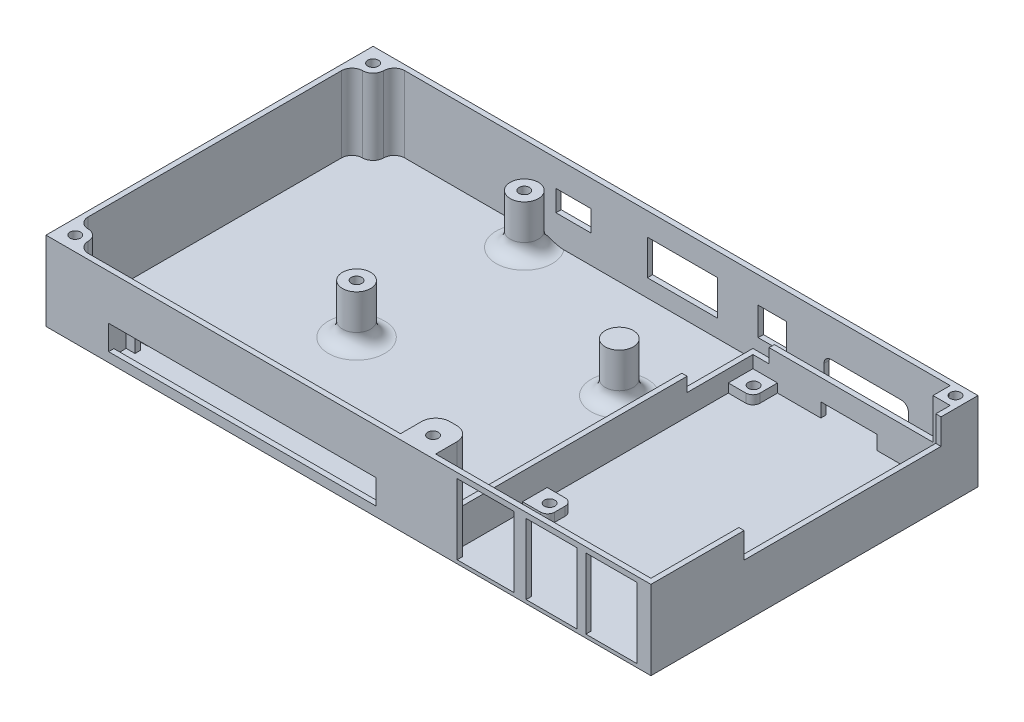
from build123d import *

# Parameters (mm, degrees)
SKETCH1_W              = 172
SKETCH1_H              = 93
BOSS_EXTRUDE1_DEPTH    = 1
SKETCH2_W              = 172
SKETCH2_H              = 93
SKETCH2_W_2            = 169
SKETCH2_H_2            = 90
BOSS_EXTRUDE2_DEPTH    = 21.5
SKETCH3_W              = 14.5
SKETCH3_H              = 20
SKETCH3_W_2            = 16.2
SKETCH3_W_3            = 76
SKETCH3_H_2            = 7
CUT_EXTRUDE1_DEPTH     = 21.5
BOSS_EXTRUDE3_DEPTH    = 10
FILLET1_R              = 4
SKETCH5_R              = 1.5
BOSS_EXTRUDE4_DEPTH    = 2.5
BOSS_EXTRUDE5_DEPTH    = 10
SKETCH7_W              = 1.5
SKETCH7_H              = 3.5
BOSS_EXTRUDE6_DEPTH    = 10
FILLET2_R              = 4
SKETCH8_R              = 4
SKETCH8_R_2            = 1.5
BOSS_EXTRUDE7_DEPTH    = 14
SKETCH10_W             = 16
SKETCH10_H             = 4
CUT_EXTRUDE2_DEPTH     = 14
CUT_EXTRUDE3_DEPTH     = 1.6
FILLET3_R              = 4
SKETCH12_W             = 10
SKETCH12_H             = 6
SKETCH12_W_2           = 8
SKETCH12_H_2           = 8
CUT_EXTRUDE4_DEPTH     = 25.1
SKETCH13_W             = 6.4
SKETCH13_H             = 6.4
SKETCH13_W_2           = 6
SKETCH13_H_2           = 6
BOSS_EXTRUDE8_DEPTH    = 21.5
FILLET4_R              = 3
SKETCH14_R             = 1.5
CUT_EXTRUDE5_DEPTH     = 20
SKETCH15_W             = 172
SKETCH15_H             = 93
SKETCH15_R             = 1.5
SKETCH15_W_2           = 4
SKETCH15_H_2           = 40
SKETCH15_W_3           = 45
SKETCH15_H_3           = 6.0381788
BOSS_EXTRUDE9_DEPTH    = 2
SKETCH16_W             = 56
SKETCH16_H             = 7.274551358
CUT_EXTRUDE6_DEPTH     = 2
INTERSECT2_START       = 22.5
INTERSECT2_OUTLINE_W   = 172
INTERSECT2_OUTLINE_H   = 93
INTERSECT2_OUTLINE_R   = 1.5
INTERSECT2_OUTLINE_W_2 = 45
INTERSECT2_OUTLINE_H_2 = 6.0381788
INTERSECT2_OUTLINE_W_3 = 4
INTERSECT2_OUTLINE_H_3 = 40
INTERSECT2_DEPTH       = 2


# Read off the part's stored shape, not the designer's step: Intersect2
# Some blends are built 0.0001 mm under size
with BuildPart() as part:
    # Sketch1 → Boss-Extrude1 (new body)
    with BuildSketch(Plane(origin=(0, 0, 0), x_dir=(1, 0, 0), z_dir=(0, 1, 0))):
        Rectangle(SKETCH1_W, SKETCH1_H)
    extrude(amount=BOSS_EXTRUDE1_DEPTH)

    # Sketch2 → Boss-Extrude2 (add)
    with BuildSketch(Plane(origin=(0, 1, 0), x_dir=(1, 0, 0), z_dir=(0, 1, 0))):
        Rectangle(SKETCH2_W, SKETCH2_H)
        Rectangle(SKETCH2_W_2, SKETCH2_H_2, mode=Mode.SUBTRACT)
    extrude(amount=BOSS_EXTRUDE2_DEPTH)

    # Sketch3 → Cut-Extrude1 (cut)
    with BuildSketch(Plane.XY.offset(46.5)):
        with Locations((74.75, 11)):
            Rectangle(SKETCH3_W, SKETCH3_H)
        with Locations((57.75, 11)):
            Rectangle(SKETCH3_W, SKETCH3_H)
        with Locations((39, 11)):
            Rectangle(SKETCH3_W_2, SKETCH3_H)
        with Locations((-30.2, 6.2)):
            Rectangle(SKETCH3_W_3, SKETCH3_H_2)
    extrude(amount=-CUT_EXTRUDE1_DEPTH, mode=Mode.SUBTRACT)

    # Sketch4 → Boss-Extrude3 (add)
    with BuildSketch(Plane(origin=(0, 1, 0), x_dir=(1, 0, 0), z_dir=(0, 1, 0))):
        Polygon((26.9, -45), (28.4, -45), (28.4, 40.1), (84.5, 40.1), (84.5, 41.6), (26.9, 41.6), align=None)
    extrude(amount=BOSS_EXTRUDE3_DEPTH)

    # Fillet1
    fillet1_edges = [part.edges().sort_by_distance(p)[0] for p in [
        (26.9, 6, 45),
    ]]
    fillet(fillet1_edges, radius=FILLET1_R)

    # Sketch5 → Boss-Extrude4 (add)
    # profile 1 of 4: a face of its own
    with BuildSketch(Plane(origin=(0, 1, 0), x_dir=(1, 0, 0), z_dir=(0, 1, 0))):
        with BuildLine():
            Line((28.4, 40.1), (35.4, 40.1))
            Line((35.4, 40.1), (35.4, 35.1))
            ThreePointArc((35.4, 35.1), (34.814213562, 33.685786438), (33.4, 33.1))
            Line((33.4, 33.1), (28.4, 33.1))
            Line((28.4, 33.1), (28.4, 40.1))
        make_face()
        with Locations(Location((32.6, 36.1, 0), (0, 0, 270))):
            Circle(SKETCH5_R, mode=Mode.SUBTRACT)
    # profile 2 of 4: a face of its own
    with BuildSketch(Plane(origin=(0, 1, 0), x_dir=(1, 0, 0), z_dir=(0, 1, 0))):
        with BuildLine():
            Line((84.5, 40.1), (77.5, 40.1))
            Line((77.5, 40.1), (77.5, 35.1))
            ThreePointArc((77.5, 35.1), (78.085786438, 33.685786438), (79.5, 33.1))
            Line((79.5, 33.1), (84.5, 33.1))
            Line((84.5, 33.1), (84.5, 40.1))
        make_face()
        with Locations(Location((80.3, 36.1, 0), (0, 0, 270))):
            Circle(SKETCH5_R, mode=Mode.SUBTRACT)
    # profile 3 of 4: a face of its own
    with BuildSketch(Plane(origin=(0, 1, 0), x_dir=(1, 0, 0), z_dir=(0, 1, 0))):
        with BuildLine():
            Line((28.4, -18.4), (33.533804299, -18.4))
            ThreePointArc((33.533804299, -18.4), (34.948017861, -18.985786438), (35.533804299, -20.4))
            Line((35.533804299, -20.4), (35.533804299, -23.4))
            ThreePointArc((35.533804299, -23.4), (34.948017861, -24.814213562), (33.533804299, -25.4))
            Line((33.533804299, -25.4), (28.4, -25.4))
            Line((28.4, -25.4), (28.4, -18.4))
        make_face()
        with Locations(Location((32.6, -21.9, 0), (0, 0, 270))):
            Circle(SKETCH5_R, mode=Mode.SUBTRACT)
    # profile 4 of 4: a face of its own
    with BuildSketch(Plane(origin=(0, 1, 0), x_dir=(1, 0, 0), z_dir=(0, 1, 0))):
        with BuildLine():
            Line((84.5, -18.4), (79.00543069, -18.4))
            ThreePointArc((79.00543069, -18.4), (77.591217128, -18.985786438), (77.00543069, -20.4))
            Line((77.00543069, -20.4), (77.00543069, -23.4))
            ThreePointArc((77.00543069, -23.4), (77.591217128, -24.814213562), (79.00543069, -25.4))
            Line((79.00543069, -25.4), (84.5, -25.4))
            Line((84.5, -25.4), (84.5, -18.4))
        make_face()
        with Locations(Location((80.3, -21.9, 0), (0, 0, 270))):
            Circle(SKETCH5_R, mode=Mode.SUBTRACT)
    extrude(amount=BOSS_EXTRUDE4_DEPTH)

    # Sketch6 → Boss-Extrude5 (add)
    with BuildSketch(Plane(origin=(0, 1, 0), x_dir=(1, 0, 0), z_dir=(0, 1, 0))):
        Polygon((-65.7, -40), (-68.2, -40), (-68.2, -37.9), (-65.7, -37.9), (-65.7, -36.402716815), (-69.7, -36.402716815), (-69.7, -41.5), (-65.7, -41.5), align=None)
        Polygon((5.3, -36.402716815), (5.3, -37.9), (7.8, -37.9), (7.8, -40), (5.3, -40), (5.3, -41.5), (9.3, -41.5), (9.3, -36.402716815), align=None)
    extrude(amount=BOSS_EXTRUDE5_DEPTH)

    # Sketch7 → Boss-Extrude6 (add)
    with BuildSketch(Plane(origin=(0, 1, 0), x_dir=(1, 0, 0), z_dir=(0, 1, 0))):
        with Locations((-68.95, -43.25)):
            Rectangle(SKETCH7_W, SKETCH7_H)
        with Locations((8.55, -43.25)):
            Rectangle(SKETCH7_W, SKETCH7_H)
    extrude(amount=BOSS_EXTRUDE6_DEPTH)

    # Fillet2
    fillet2_edges = [part.edges().sort_by_distance(p)[0] for p in [
        (-69.7, 6, 45),
        (9.3, 6, 45),
    ]]
    fillet(fillet2_edges, radius=FILLET2_R)

    # Sketch8 → Boss-Extrude7 (add)
    # profile 1 of 3: a face of its own
    with BuildSketch(Plane(origin=(0, 1, 0), x_dir=(1, 0, 0), z_dir=(0, 1, 0))):
        with Locations(Location((-38.2, -6, 0), (0, 0, 90))):
            Circle(SKETCH8_R)
        with Locations(Location((-38.2, -6, 0), (0, 0, 270))):
            Circle(SKETCH8_R_2, mode=Mode.SUBTRACT)
    # profile 2 of 3: a face of its own
    with BuildSketch(Plane(origin=(0, 1, 0), x_dir=(1, 0, 0), z_dir=(0, 1, 0))):
        with Locations(Location((-36.5, 40, 0), (0, 0, 90))):
            Circle(SKETCH8_R)
        with Locations(Location((-36.5, 40, 0), (0, 0, 270))):
            Circle(SKETCH8_R_2, mode=Mode.SUBTRACT)
    # profile 3 of 3: a face of its own
    with BuildSketch(Plane(origin=(0, 1, 0), x_dir=(1, 0, 0), z_dir=(0, 1, 0))):
        with Locations(Location((13.5, 17, 0), (0, 0, 90))):
            Circle(SKETCH8_R)
    extrude(amount=BOSS_EXTRUDE7_DEPTH)

    # Sketch10 → Cut-Extrude2 (cut)
    with BuildSketch(Plane(origin=(0, 0, -46.5), x_dir=(-1, 0, 0), z_dir=(0, 0, -1))):
        with Locations((-55.7, 3)):
            Rectangle(SKETCH10_W, SKETCH10_H)
    extrude(amount=-CUT_EXTRUDE2_DEPTH, mode=Mode.SUBTRACT)

    # Sketch11 → Cut-Extrude3 (cut)
    with BuildSketch(Plane(origin=(0, 0, -46.5), x_dir=(-1, 0, 0), z_dir=(0, 0, -1))):
        with BuildLine():
            Line((-65.7, 12), (-45.7, 12))
            ThreePointArc((-45.7, 12), (-44.285786438, 11.414213562), (-43.7, 10))
            Line((-43.7, 10), (-43.7, 3))
            ThreePointArc((-43.7, 3), (-44.285786438, 1.585786438), (-45.7, 1))
            Line((-45.7, 1), (-65.7, 1))
            ThreePointArc((-65.7, 1), (-67.114213562, 1.585786438), (-67.7, 3))
            Line((-67.7, 3), (-67.7, 10))
            ThreePointArc((-67.7, 10), (-67.114213562, 11.414213562), (-65.7, 12))
        make_face()
    extrude(amount=-CUT_EXTRUDE3_DEPTH, mode=Mode.SUBTRACT)

    # Fillet3
    # the kernel refuses this fillet: 4 mm, written as the material it adds along each edge
    with BuildSketch(Plane(origin=(-36.5, 1, -40), x_dir=(0, 0, -1), z_dir=(1, 0, 0))) as fillet3_piece_1_section:
        with BuildLine():
            CenterArc((4 + FILLET3_R, FILLET3_R), FILLET3_R, 180, 90)
            Line((4, FILLET3_R), (4, 0))
            Line((4, 0), (4 + FILLET3_R, 0))
        make_face()
    fillet3_piece_1 = revolve(axis=Axis((-36.5, 1, -40), (0, 1, 0)), mode=Mode.PRIVATE)
    fillet3_piece_1 = split(fillet3_piece_1, bisect_by=Plane(origin=(-36.5, 2.138882343, -45), z_dir=(0, 0, 1)), keep=Keep.TOP, mode=Mode.PRIVATE)
    add(fillet3_piece_1)
    with BuildSketch(Plane(origin=(-38.2, 1, 6), x_dir=(0, 0, -1), z_dir=(1, 0, 0))) as fillet3_piece_2:
        with BuildLine():
            CenterArc((4 + FILLET3_R, FILLET3_R), FILLET3_R, 180, 90)
            Line((4, FILLET3_R), (4, 0))
            Line((4, 0), (4 + FILLET3_R, 0))
        make_face()
    revolve(axis=Axis((-38.2, 1, 6), (0, 1, 0)))
    with BuildSketch(Plane(origin=(13.5, 1, -17), x_dir=(0, 0, -1), z_dir=(1, 0, 0))) as fillet3_piece_3:
        with BuildLine():
            CenterArc((4 + FILLET3_R, FILLET3_R), FILLET3_R, 180, 90)
            Line((4, FILLET3_R), (4, 0))
            Line((4, 0), (4 + FILLET3_R, 0))
        make_face()
    revolve(axis=Axis((13.5, 1, -17), (0, 1, 0)))

    # Sketch12 → Cut-Extrude4 (cut)
    with BuildSketch(Plane(origin=(0, 0, -46.5), x_dir=(-1, 0, 0), z_dir=(0, 0, -1))):
        with Locations((27.5, 12)):
            Rectangle(SKETCH12_W, SKETCH12_H)
        Polygon((-13.5, 15), (-13.5, 16), (6.5, 16), (6.5, 15), (6.5, 6), (-13.5, 6), align=None)
        with Locations((-29, 11)):
            Rectangle(SKETCH12_W_2, SKETCH12_H_2)
    extrude(amount=-CUT_EXTRUDE4_DEPTH, mode=Mode.SUBTRACT)

    # Sketch13 → Boss-Extrude8 (add)
    with BuildSketch(Plane(origin=(0, 1, 0), x_dir=(1, 0, 0), z_dir=(0, 1, 0))):
        with Locations((82.8, 43.3)):
            Rectangle(SKETCH13_W, SKETCH13_H)
        with Locations((-81.5, 42)):
            Rectangle(SKETCH13_W_2, SKETCH13_H_2)
        with Locations((-81.5, -42)):
            Rectangle(SKETCH13_W_2, SKETCH13_H_2)
        with BuildLine():
            Line((13.3, -45), (23.3, -45))
            Line((23.3, -45), (23.3, -39))
            ThreePointArc((23.3, -39), (22.128427125, -36.171572875), (19.3, -35))
            Line((19.3, -35), (17.3, -35))
            ThreePointArc((17.3, -35), (14.471572875, -36.171572875), (13.3, -39))
            Line((13.3, -39), (13.3, -45))
        make_face()
    extrude(amount=BOSS_EXTRUDE8_DEPTH)

    # Fillet4
    fillet4_edges = [part.edges().sort_by_distance(p)[0] for p in [
        (-78.5, 11.75, 39),
        (-78.5, 11.75, 45),
        (-84.5, 11.75, 39),
        (-78.5, 11.75, -39),
        (-78.5, 11.75, -45),
        (-84.5, 11.75, -39),
    ]]
    fillet(fillet4_edges, radius=FILLET4_R - 0.0001)  # a hair under: the kernel refuses the full size

    # Sketch14 → Cut-Extrude5 (cut)
    with BuildSketch(Plane(origin=(0, 22.5, 0), x_dir=(1, 0, 0), z_dir=(0, 1, 0))):
        with Locations(Location((-81.844819979, 42.344819979, 0), (0, 0, 270))):
            Circle(SKETCH14_R)
        with Locations(Location((-81.844819979, -42.344819979, 0), (0, 0, 270))):
            Circle(SKETCH14_R)
        with Locations(Location((18.3, -40.75, 0), (0, 0, 270))):
            Circle(SKETCH14_R)
        with Locations(Location((82.8, 43.3, 0), (0, 0, 270))):
            Circle(SKETCH14_R)
    extrude(amount=-CUT_EXTRUDE5_DEPTH, mode=Mode.SUBTRACT)

    # Sketch16 → Cut-Extrude6 (cut)
    with BuildSketch(Plane(origin=(86, 0, 0), x_dir=(0, 0, -1), z_dir=(1, 0, 0))):
        with Locations((8, 18.862724321)):
            Rectangle(SKETCH16_W, SKETCH16_H)
    extrude(amount=-CUT_EXTRUDE6_DEPTH, mode=Mode.SUBTRACT)


with BuildPart() as body_2:
    # Sketch15 → Boss-Extrude9 (new body)
    with BuildSketch(Plane(origin=(0, 22.5, 0), x_dir=(1, 0, 0), z_dir=(0, 1, 0))):
        Rectangle(SKETCH15_W, SKETCH15_H)
        with Locations(Location((82.8, 43.3, 0), (0, 0, 270))):
            Circle(SKETCH15_R, mode=Mode.SUBTRACT)
        with Locations(Location((18.3, -40.75, 0), (0, 0, 270))):
            Circle(SKETCH15_R, mode=Mode.SUBTRACT)
        with Locations(Location((-81.844819979, -42.344819979, 0), (0, 0, 270))):
            Circle(SKETCH15_R, mode=Mode.SUBTRACT)
        with Locations(Location((-81.844819979, 42.344819979, 0), (0, 0, 270))):
            Circle(SKETCH15_R, mode=Mode.SUBTRACT)
        with Locations((-54.124331846, 14.769848195)):
            Rectangle(SKETCH15_W_2, SKETCH15_H_2, mode=Mode.SUBTRACT)
        with Locations((-64.124331846, 14.769848195)):
            Rectangle(SKETCH15_W_2, SKETCH15_H_2, mode=Mode.SUBTRACT)
        with Locations((-44.124331846, 14.769848195)):
            Rectangle(SKETCH15_W_2, SKETCH15_H_2, mode=Mode.SUBTRACT)
        with Locations((-34.124331846, 14.769848195)):
            Rectangle(SKETCH15_W_2, SKETCH15_H_2, mode=Mode.SUBTRACT)
        with Locations((-24.124331846, 14.769848195)):
            Rectangle(SKETCH15_W_2, SKETCH15_H_2, mode=Mode.SUBTRACT)
        with Locations((-14.124331846, 14.769848195)):
            Rectangle(SKETCH15_W_2, SKETCH15_H_2, mode=Mode.SUBTRACT)
        with Locations((-4.124331846, 14.769848195)):
            Rectangle(SKETCH15_W_2, SKETCH15_H_2, mode=Mode.SUBTRACT)
        with Locations((5.875668154, 14.769848195)):
            Rectangle(SKETCH15_W_2, SKETCH15_H_2, mode=Mode.SUBTRACT)
        with Locations((15.875668154, 14.769848195)):
            Rectangle(SKETCH15_W_2, SKETCH15_H_2, mode=Mode.SUBTRACT)
        with Locations((0, -31.942161626)):
            Rectangle(SKETCH15_W_3, SKETCH15_H_3, mode=Mode.SUBTRACT)
    extrude(amount=BOSS_EXTRUDE9_DEPTH)

    # Intersect2 outline → Intersect2 (cut)
    with BuildSketch(Plane(origin=(0, 0, 0), x_dir=(1, 0, 0), z_dir=(0, 1, 0)).offset(INTERSECT2_START)):
        Rectangle(INTERSECT2_OUTLINE_W, INTERSECT2_OUTLINE_H)
        with Locations((-81.844819979, -42.344819979)):
            Circle(INTERSECT2_OUTLINE_R, mode=Mode.SUBTRACT)
        with Locations((18.3, -40.75)):
            Circle(INTERSECT2_OUTLINE_R, mode=Mode.SUBTRACT)
        with Locations((0, -31.942161626)):
            Rectangle(INTERSECT2_OUTLINE_W_2, INTERSECT2_OUTLINE_H_2, mode=Mode.SUBTRACT)
        with Locations((-64.124331846, 14.769848195)):
            Rectangle(INTERSECT2_OUTLINE_W_3, INTERSECT2_OUTLINE_H_3, mode=Mode.SUBTRACT)
        with Locations((-54.124331846, 14.769848195)):
            Rectangle(INTERSECT2_OUTLINE_W_3, INTERSECT2_OUTLINE_H_3, mode=Mode.SUBTRACT)
        with Locations((-44.124331846, 14.769848195)):
            Rectangle(INTERSECT2_OUTLINE_W_3, INTERSECT2_OUTLINE_H_3, mode=Mode.SUBTRACT)
        with Locations((-34.124331846, 14.769848195)):
            Rectangle(INTERSECT2_OUTLINE_W_3, INTERSECT2_OUTLINE_H_3, mode=Mode.SUBTRACT)
        with Locations((-24.124331846, 14.769848195)):
            Rectangle(INTERSECT2_OUTLINE_W_3, INTERSECT2_OUTLINE_H_3, mode=Mode.SUBTRACT)
        with Locations((-14.124331846, 14.769848195)):
            Rectangle(INTERSECT2_OUTLINE_W_3, INTERSECT2_OUTLINE_H_3, mode=Mode.SUBTRACT)
        with Locations((-4.124331846, 14.769848195)):
            Rectangle(INTERSECT2_OUTLINE_W_3, INTERSECT2_OUTLINE_H_3, mode=Mode.SUBTRACT)
        with Locations((-81.844819979, 42.344819979)):
            Circle(INTERSECT2_OUTLINE_R, mode=Mode.SUBTRACT)
        with Locations((5.875668154, 14.769848195)):
            Rectangle(INTERSECT2_OUTLINE_W_3, INTERSECT2_OUTLINE_H_3, mode=Mode.SUBTRACT)
        with Locations((15.875668154, 14.769848195)):
            Rectangle(INTERSECT2_OUTLINE_W_3, INTERSECT2_OUTLINE_H_3, mode=Mode.SUBTRACT)
        with Locations((82.8, 43.3)):
            Circle(INTERSECT2_OUTLINE_R, mode=Mode.SUBTRACT)
    extrude(amount=INTERSECT2_DEPTH, mode=Mode.SUBTRACT)


solid = part.part
